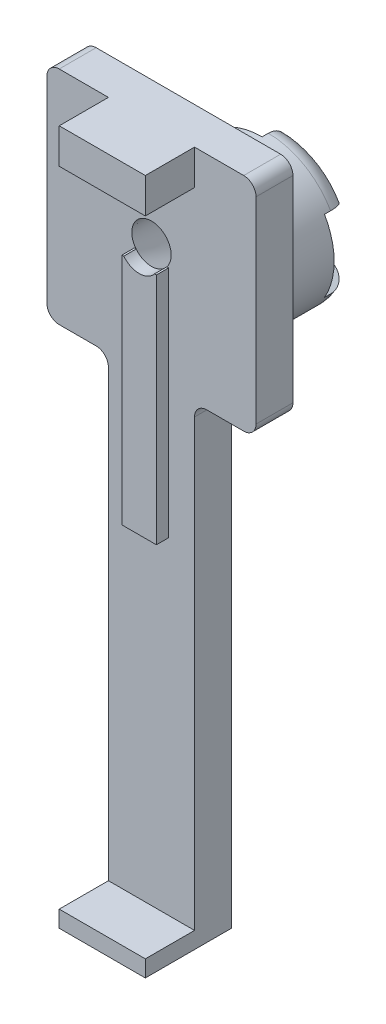
from build123d import *

# Parameters (mm, degrees)
SKETCH1_W           = 7
SKETCH1_H           = 56.5
BOSS_EXTRUDE1_DEPTH = 3
SKETCH2_W           = 2.8
SKETCH2_H           = 19
BOSS_EXTRUDE2_DEPTH = 1
SKETCH3_W           = 7
SKETCH3_H           = 2.85
SKETCH3_H_2         = 1.35
BOSS_EXTRUDE3_DEPTH = 4
SKETCH4_W           = 3
SKETCH4_H           = 18
BOSS_EXTRUDE4_DEPTH = 5
SKETCH5_W           = 3
SKETCH5_H           = 18
BOSS_EXTRUDE5_DEPTH = 5
SKETCH9_R           = 5.85
BOSS_EXTRUDE7_DEPTH = 8
FILLET1_R           = 1.5
FILLET2_R           = 1
SKETCH11_R          = 3.436863838
SKETCH7_R           = 1.6
CUT_EXTRUDE5_START  = -2
CUT_EXTRUDE5_DEPTH  = 2
SKETCH14_R          = 1.6
CUT_EXTRUDE6_DEPTH  = 3


with BuildPart() as part:
    # Sketch1 → Boss-Extrude1 (new body)
    with BuildSketch(Plane.XY):
        with Locations((0, 9.795104227)):
            Rectangle(SKETCH1_W, SKETCH1_H)
    extrude(amount=BOSS_EXTRUDE1_DEPTH)

    # Sketch2 → Boss-Extrude2 (add)
    with BuildSketch(Plane.XY.offset(3)):
        with Locations((0, 18.995104227)):
            Rectangle(SKETCH2_W, SKETCH2_H)
    extrude(amount=BOSS_EXTRUDE2_DEPTH)

    # Sketch3 → Boss-Extrude3 (add)
    with BuildSketch(Plane.XY.offset(3)):
        with Locations((0, 36.620104227)):
            Rectangle(SKETCH3_W, SKETCH3_H)
        with Locations((0, -17.779895773)):
            Rectangle(SKETCH3_W, SKETCH3_H_2)
    extrude(amount=BOSS_EXTRUDE3_DEPTH)

    # Sketch4 → Boss-Extrude4 (add)
    with BuildSketch(Plane.ZY.offset(3.5)):
        with Locations((1.5, 29.045104227)):
            Rectangle(SKETCH4_W, SKETCH4_H)
    extrude(amount=BOSS_EXTRUDE4_DEPTH)

    # Sketch5 → Boss-Extrude5 (add)
    with BuildSketch(Plane(origin=(3.5, 0, 0), x_dir=(0, 0, -1), z_dir=(1, 0, 0))):
        with Locations((-1.5, 29.045104227)):
            Rectangle(SKETCH5_W, SKETCH5_H)
    extrude(amount=BOSS_EXTRUDE5_DEPTH)

    # Sketch9 → Boss-Extrude7 (add)
    with BuildSketch(Plane(origin=(0, 0, 0), x_dir=(-1, 0, 0), z_dir=(0, 0, -1))):
        with Locations(Location((0, 26.670104227, 0), (0, 0, 180))):
            Circle(SKETCH9_R)
    extrude(amount=BOSS_EXTRUDE7_DEPTH)

    # Fillet1
    fillet1_edges = [part.edges().sort_by_distance(p)[0] for p in [
        (-5.85, 26.670104227, -8),
    ]]
    fillet(fillet1_edges, radius=FILLET1_R)

    # Fillet2
    fillet2_edges = [part.edges().sort_by_distance(p)[0] for p in [
        (-3.5, 20.045104227, 1.5),
        (-8.5, 20.045104227, 1.5),
        (-8.5, 38.045104227, 1.5),
        (3.5, 20.045104227, 1.5),
        (8.5, 38.045104227, 1.5),
        (8.5, 20.045104227, 1.5),
    ]]
    fillet(fillet2_edges, radius=FILLET2_R)

    # Sketch11 → Cut-Loft6 section 0
    with BuildSketch(Plane(origin=(0, 0, -8), x_dir=(-1, 0, 0), z_dir=(0, 0, -1))):
        with Locations((0, 26.670104227)):
            Circle(SKETCH11_R)
    # Sketch7 → Cut-Loft6 section 1
    with BuildSketch(Plane.XY.offset(3)):
        with Locations((0, 29.495104227)):
            Circle(SKETCH7_R)
    loft(mode=Mode.SUBTRACT)

    # Cut-Extrude5: read off the stored shape, not the designer's step
    # Cut-Extrude5 outline → Cut-Extrude5 (cut)
    with BuildSketch(Plane(origin=(0, 0, -8), x_dir=(-1, 0, 0), z_dir=(0, 0, -1)).offset(CUT_EXTRUDE5_START)):
        with BuildLine():
            ThreePointArc((5.066248612, 29.595104227), (2.925, 31.736352839), (0, 32.520104227))
            Line((0, 32.520104227), (0, 26.670104227))
            Line((0, 26.670104227), (5.066248612, 29.595104227))
        make_face()
        with BuildLine():
            Line((0, 26.670104227), (-5.066248612, 29.595104227))
            ThreePointArc((-5.066248612, 29.595104227), (-5.85, 26.670104227), (-5.066248612, 23.745104227))
            Line((-5.066248612, 23.745104227), (0, 26.670104227))
        make_face()
        with BuildLine():
            Line((5.066248612, 23.745104227), (0, 26.670104227))
            Line((0, 26.670104227), (0, 20.820104227))
            ThreePointArc((0, 20.820104227), (2.925, 21.603855615), (5.066248612, 23.745104227))
        make_face()
    extrude(amount=CUT_EXTRUDE5_DEPTH, mode=Mode.SUBTRACT)

    # Sketch14 → Cut-Extrude6 (cut)
    with BuildSketch(Plane.XY.offset(3)):
        with Locations((0, 29.495104227)):
            Circle(SKETCH14_R)
    extrude(amount=CUT_EXTRUDE6_DEPTH, mode=Mode.SUBTRACT)


solid = part.part
